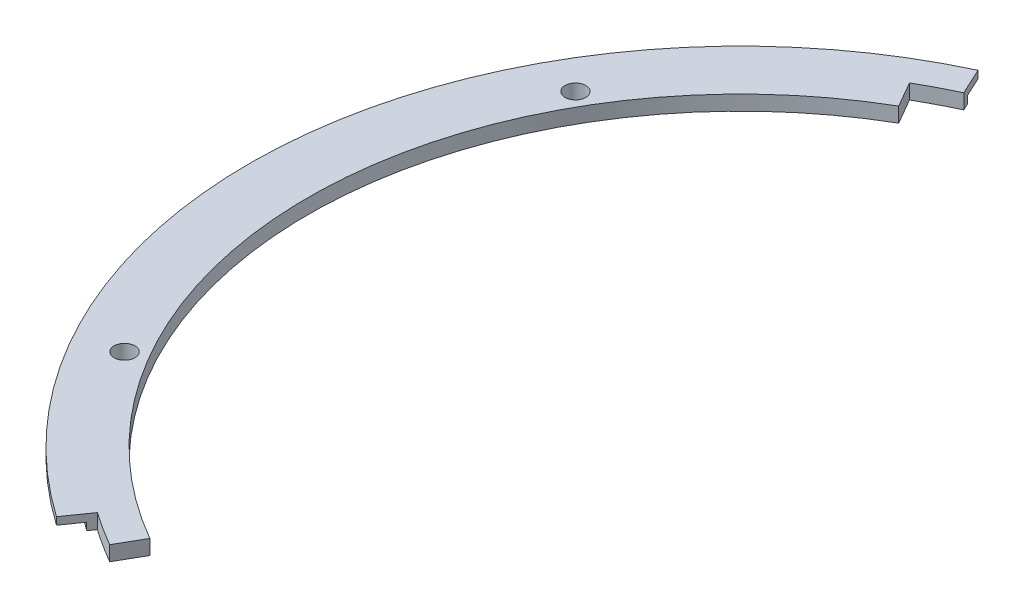
from build123d import *

# Parameters (mm, degrees)
SKETCH1_R           = 160.85
SKETCH1_R_2         = 3.556
SKETCH1_R_3         = 148.15
BOSS_EXTRUDE1_DEPTH = 5.08
BOSS_EXTRUDE2_START = -2.54
SKETCH2_R           = 168.275
SKETCH2_R_2         = 160.85
BOSS_EXTRUDE2_DEPTH = 2.54
CUT_EXTRUDE1_DEPTH  = 239.031001447


with BuildPart() as part:
    # Sketch1 → Boss-Extrude1 (new body)
    with BuildSketch(Plane(origin=(0, 0, 0), x_dir=(1, 0, 0), z_dir=(0, 1, 0))):
        Circle(SKETCH1_R)
        with Locations((0, 154.5)):
            Circle(SKETCH1_R_2, mode=Mode.SUBTRACT)
        with Locations((133.800924885, 77.25)):
            Circle(SKETCH1_R_2, mode=Mode.SUBTRACT)
        with Locations((133.800924885, -77.25)):
            Circle(SKETCH1_R_2, mode=Mode.SUBTRACT)
        with Locations((0, -154.5)):
            Circle(SKETCH1_R_2, mode=Mode.SUBTRACT)
        with Locations((-133.800924885, -77.25)):
            Circle(SKETCH1_R_2, mode=Mode.SUBTRACT)
        with Locations((-133.800924885, 77.25)):
            Circle(SKETCH1_R_2, mode=Mode.SUBTRACT)
        Circle(SKETCH1_R_3, mode=Mode.SUBTRACT)
    extrude(amount=BOSS_EXTRUDE1_DEPTH)

    # Sketch2 → Boss-Extrude2 (add)
    with BuildSketch(Plane(origin=(0, 5.08, 0), x_dir=(1, 0, 0), z_dir=(0, 1, 0)).offset(BOSS_EXTRUDE2_START)):
        Circle(SKETCH2_R)
        Circle(SKETCH2_R_2, mode=Mode.SUBTRACT)
    extrude(amount=BOSS_EXTRUDE2_DEPTH)

    # Sketch3 → Cut-Extrude1 (cut, through all)
    with BuildSketch(Plane(origin=(0, 5.08, 0), x_dir=(1, 0, 0), z_dir=(0, 1, 0))):
        with BuildLine():
            Line((-88.9, 153.979316793), (-84.1375, 145.730424822))
            ThreePointArc((-84.1375, 145.730424822), (-77.700747892, 149.261747953), (-71.116087994, 152.508942864))
            Line((-71.116087994, 152.508942864), (-66.863491736, 143.389220757))
            ThreePointArc((-66.863491736, 143.389220757), (-73.054402471, 140.336201444), (-79.10625, 137.016044196))
            Line((-79.10625, 137.016044196), (0, 0))
            Line((0, 0), (-79.10625, -137.016044196))
            ThreePointArc((-79.10625, -137.016044196), (-85.007514286, -133.435069121), (-90.746961936, -129.600092807))
            Line((-90.746961936, -129.600092807), (-96.518574827, -137.842810253))
            ThreePointArc((-96.518574827, -137.842810253), (-90.414091595, -141.921695544), (-84.1375, -145.730424822))
            Line((-84.1375, -145.730424822), (-88.9, -153.979316793))
            ThreePointArc((-88.9, -153.979316793), (177.8, 0), (-88.9, 153.979316793))
        make_face()
    extrude(amount=-CUT_EXTRUDE1_DEPTH, mode=Mode.SUBTRACT)


solid = part.part
